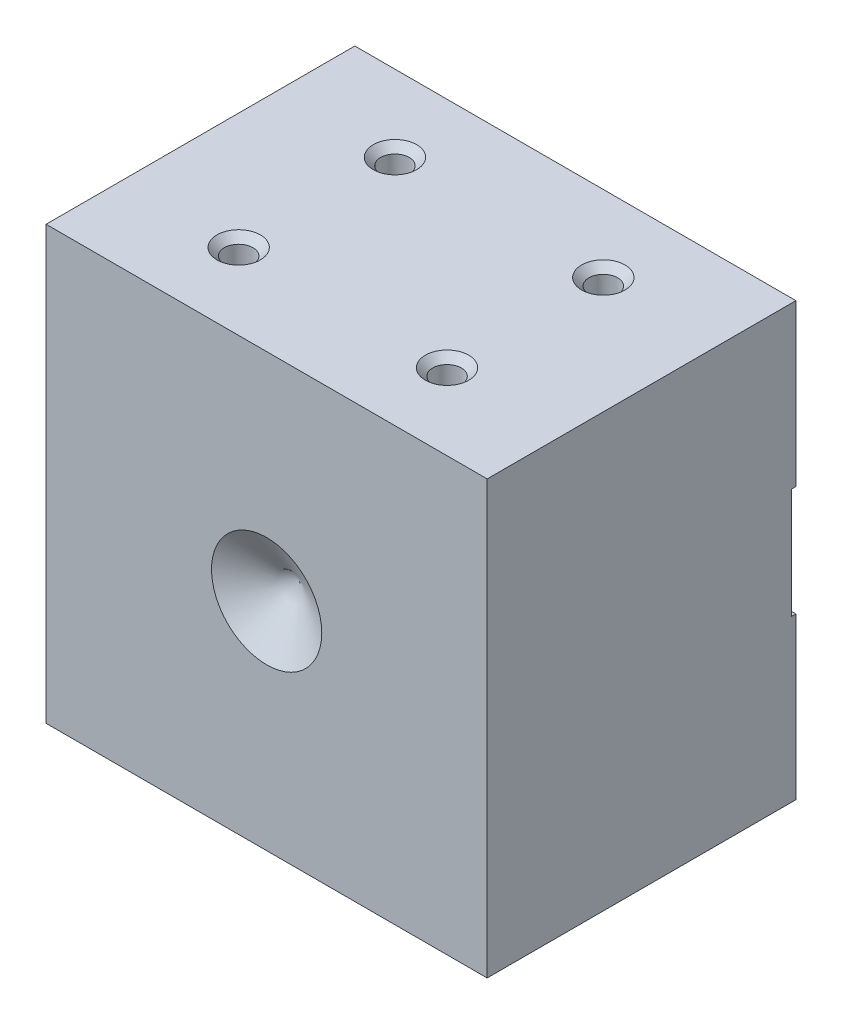
from build123d import *

# Parameters (mm, degrees)
SKETCH1_W                       = 49.784
SKETCH1_H                       = 35.56
BOSS_EXTRUDE1_DEPTH             = 50.8
M4X0_7_TAPPED_HOLE1_AT_2_COUNT  = 2
M4X0_7_TAPPED_HOLE1_AT_2_PITCH  = 30
M4X0_7_TAPPED_HOLE1_AT_3_COUNT  = 2
M4X0_7_TAPPED_HOLE1_AT_3_PITCH  = 18
M4X0_7_TAPPED_HOLE1_AT_4_COUNT  = 2
M4X0_7_TAPPED_HOLE1_AT_4_PITCH  = 24
CUT_EXTRUDE2_DEPTH              = 0.508
MIRROR2_START                   = -17.78
MIRROR2_DEPTH                   = 0.508
M5X0_8_TAPPED_HOLE1_D           = 4.2
M5X0_8_TAPPED_HOLE1_DEPTH       = 12.192
M5X0_8_TAPPED_HOLE1_CSINK_D     = 6
M5X0_8_TAPPED_HOLE1_CSINK_ANGLE = 90
M5X0_8_TAPPED_HOLE1_TIP         = 1.2618073


# Read off the part's stored shape, not the designer's step: Mirror2
with BuildPart() as part:
    # Sketch1 → Boss-Extrude1 (new body)
    with BuildSketch(Plane.YZ):
        Rectangle(SKETCH1_W, SKETCH1_H)
    extrude(amount=BOSS_EXTRUDE1_DEPTH)

    # Sketch3 → M4x0.7 Tapped Hole1 (revolve, cut)
    with BuildSketch(Plane(origin=(13.4, -24.892, -9), x_dir=(0, 0, -1), z_dir=(1, 0, 0))):
        Polygon((0, 0), (0, 10.897420021), (1.65, 9.906), (1.65, 0.85), (2.5, 0), align=None)
    m4x0_7_tapped_hole1 = revolve(axis=Axis((13.4, -31.242, -9), (0, 1, 0)), mode=Mode.SUBTRACT)

    # M4x0.7 Tapped Hole1 at 2: M4x0.7 Tapped Hole1 ×2
    with Locations(*[Vector(0.8000000000000002, 0, 0.5999999999999998) * (i * M4X0_7_TAPPED_HOLE1_AT_2_PITCH) for i in range(1, M4X0_7_TAPPED_HOLE1_AT_2_COUNT)]):
        add(m4x0_7_tapped_hole1, mode=Mode.SUBTRACT)

    # M4x0.7 Tapped Hole1 at 3: M4x0.7 Tapped Hole1 ×2
    with Locations(*[(0, 0, i * M4X0_7_TAPPED_HOLE1_AT_3_PITCH) for i in range(1, M4X0_7_TAPPED_HOLE1_AT_3_COUNT)]):
        add(m4x0_7_tapped_hole1, mode=Mode.SUBTRACT)

    # M4x0.7 Tapped Hole1 at 4: M4x0.7 Tapped Hole1 ×2
    with Locations(*[(i * M4X0_7_TAPPED_HOLE1_AT_4_PITCH, 0, 0) for i in range(1, M4X0_7_TAPPED_HOLE1_AT_4_COUNT)]):
        add(m4x0_7_tapped_hole1, mode=Mode.SUBTRACT)

    # Mirror1: M4x0.7 Tapped Hole1 across plane
    add(m4x0_7_tapped_hole1.mirror(Plane.ZX), mode=Mode.SUBTRACT)

    # Mirror1 copy 1 sketch → Mirror1 copy 1 (revolve, cut)
    with BuildSketch(Plane(origin=(37.4, 24.892, 9), x_dir=(0, 0, -1), z_dir=(1, 0, 0))):
        Polygon((0, 0), (0, -10.897420021), (1.65, -9.906), (1.65, -0.85), (2.5, 0), align=None)
    revolve(axis=Axis((37.4, 31.242, 9), (0, 1, 0)), mode=Mode.SUBTRACT)

    # Mirror1 copy 2 sketch → Mirror1 copy 2 (revolve, cut)
    with BuildSketch(Plane(origin=(13.4, 24.892, 9), x_dir=(0, 0, -1), z_dir=(1, 0, 0))):
        Polygon((0, 0), (0, -10.897420021), (1.65, -9.906), (1.65, -0.85), (2.5, 0), align=None)
    revolve(axis=Axis((13.4, 31.242, 9), (0, 1, 0)), mode=Mode.SUBTRACT)

    # Mirror1 copy 3 sketch → Mirror1 copy 3 (revolve, cut)
    with BuildSketch(Plane(origin=(37.4, 24.892, -9), x_dir=(0, 0, -1), z_dir=(1, 0, 0))):
        Polygon((0, 0), (0, -10.897420021), (1.65, -9.906), (1.65, -0.85), (2.5, 0), align=None)
    revolve(axis=Axis((37.4, 31.242, -9), (0, 1, 0)), mode=Mode.SUBTRACT)

    # Sketch5 → Cut-Revolve1 (revolve, cut)
    with BuildSketch(Plane(origin=(0, 0, 0), x_dir=(-1, 0, 0), z_dir=(0, 1, 0))):
        Polygon((-25.4, 17.78), (-25.4, 13.964535069), (-31.75, 17.78), align=None)
    revolve(axis=Axis((25.4, 0, 17.78), (0, 0, -1)), mode=Mode.SUBTRACT)

    # Sketch9 → Cut-Extrude2 (cut)
    with BuildSketch(Plane(origin=(0, 0, -17.78), x_dir=(1, 0, 0), z_dir=(0, 0, -1))):
        with BuildLine():
            Line((25.4, 12.7), (31.75, 12.7))
            ThreePointArc((31.75, 12.7), (34.925, 15.875), (38.1, 12.7))
            Line((38.1, 12.7), (38.1, 6.35))
            Line((38.1, 6.35), (50.8, 6.35))
            Line((50.8, 6.35), (50.8, 0))
            Line((50.8, 0), (25.4, 0))
            Line((25.4, 0), (25.4, 12.7))
        make_face()
    extrude(amount=-CUT_EXTRUDE2_DEPTH, mode=Mode.SUBTRACT)

    # Mirror2 outline → Mirror2 (cut)
    with BuildSketch(Plane.XY.offset(MIRROR2_START)):
        with BuildLine():
            Line((38.1, 6.35), (38.1, 12.7))
            ThreePointArc((38.1, 12.7), (34.925, 15.875), (31.75, 12.7))
            Line((31.75, 12.7), (19.05, 12.7))
            ThreePointArc((19.05, 12.7), (15.875, 15.875), (12.7, 12.7))
            Line((12.7, 12.7), (12.7, 6.35))
            Line((12.7, 6.35), (0, 6.35))
            Line((0, 6.35), (0, -6.35))
            Line((0, -6.35), (12.7, -6.35))
            Line((12.7, -6.35), (12.7, -12.7))
            ThreePointArc((12.7, -12.7), (15.875, -15.875), (19.05, -12.7))
            Line((19.05, -12.7), (25.4, -12.7))
            Line((25.4, -12.7), (25.4, 0))
            Line((25.4, 0), (50.8, 0))
            Line((50.8, 0), (50.8, 6.35))
            Line((50.8, 6.35), (38.1, 6.35))
        make_face()
    extrude(amount=MIRROR2_DEPTH, mode=Mode.SUBTRACT)

    # M5x0.8 Tapped Hole1
    with Locations(Plane(origin=(0, 0, -17.272), x_dir=(1, 0, 0), z_dir=(0, 0, -1))):
        with Locations((44.45, 0)):
            CounterSinkHole(M5X0_8_TAPPED_HOLE1_D / 2, M5X0_8_TAPPED_HOLE1_CSINK_D / 2, depth=M5X0_8_TAPPED_HOLE1_DEPTH, counter_sink_angle=M5X0_8_TAPPED_HOLE1_CSINK_ANGLE)
            with Locations((0, 0, -(M5X0_8_TAPPED_HOLE1_DEPTH + M5X0_8_TAPPED_HOLE1_TIP / 2))):  # 118° drill point
                Cone(0, M5X0_8_TAPPED_HOLE1_D / 2, M5X0_8_TAPPED_HOLE1_TIP, mode=Mode.SUBTRACT)


solid = part.part
